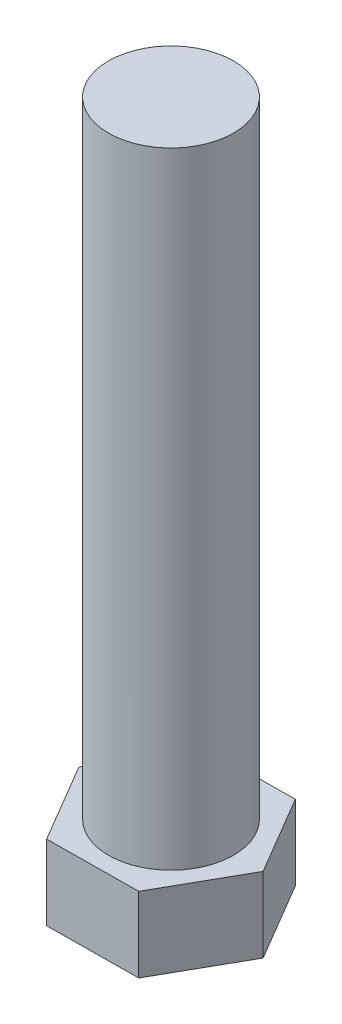
from build123d import *

# Parameters (mm, degrees)
SKETCH_1_R      = 5
EXTRUDE_1_DEPTH = 50
EXTRUDE_2_DEPTH = 6


with BuildPart() as part:
    # Эскиз1 → Бобышка-Вытянуть1 (new body)
    with BuildSketch(Plane(origin=(0, 0, 0), x_dir=(1, 0, 0), z_dir=(0, 1, 0))):
        Circle(SKETCH_1_R)
    extrude(amount=EXTRUDE_1_DEPTH)

    # Эскиз2 → Бобышка-Вытянуть2 (add)
    with BuildSketch(Plane.XZ):
        Polygon((3.706225124, 6.285050348), (-3.589900704, 6.352210283), (-7.296125827, 0.067159935), (-3.706225124, -6.285050348), (3.589900704, -6.352210283), (7.296125827, -0.067159935), align=None)
    extrude(amount=EXTRUDE_2_DEPTH)


solid = part.part
